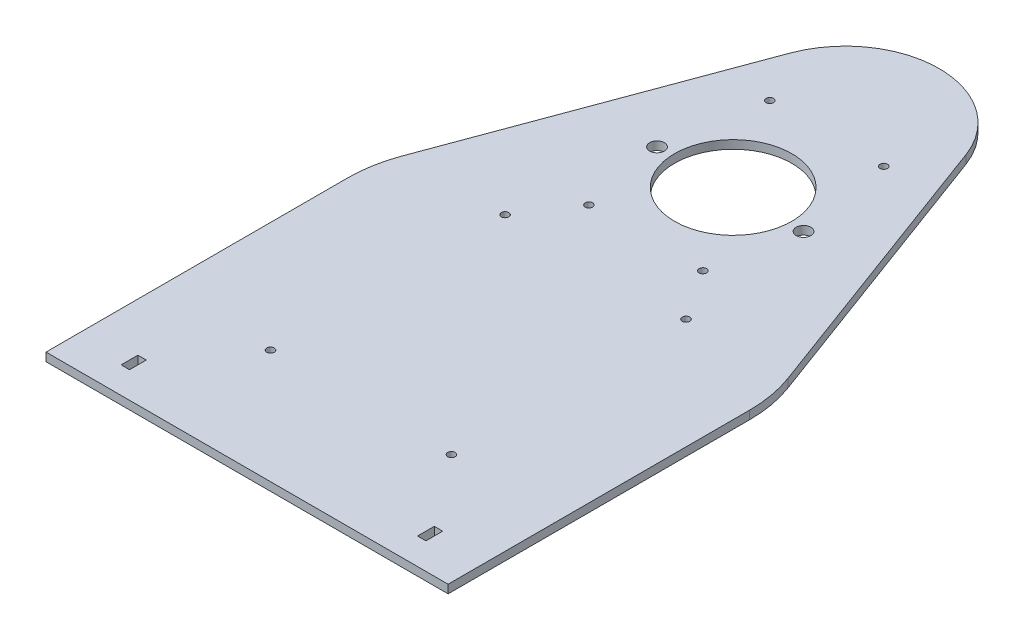
from build123d import *

# Parameters (mm, degrees)
SKETCH3_R           = 22.225
SKETCH3_R_2         = 2.778125
SKETCH3_R_3         = 1.4224
SKETCH3_W           = 3.175
SKETCH3_H           = 6.35
BOSS_EXTRUDE1_DEPTH = 3.175


with BuildPart() as part:
    # Sketch3 → Boss-Extrude1 (new body)
    with BuildSketch(Plane(origin=(0, 0, 0), x_dir=(1, 0, 0), z_dir=(0, 1, 0))):
        with BuildLine():
            Line((0, 0), (0, 114.3))
            ThreePointArc((0, 114.3), (0.796571799, 123.260868714), (3.161305831, 131.940714778))
            Line((3.161305831, 131.940714778), (42.852914082, 239.127776658))
            ThreePointArc((42.852914082, 239.127776658), (76.2, 262.339276313), (109.547085918, 239.127776658))
            Line((109.547085918, 239.127776658), (149.238694169, 131.940714778))
            ThreePointArc((149.238694169, 131.940714778), (151.603428201, 123.260868714), (152.4, 114.3))
            Line((152.4, 114.3), (152.4, 0))
            Line((152.4, 0), (0, 0))
        make_face()
        with Locations((76.2, 184.24413735)):
            Circle(SKETCH3_R, mode=Mode.SUBTRACT)
        with Locations((103.959813902, 183.152998641)):
            Circle(SKETCH3_R_2, mode=Mode.SUBTRACT)
        with Locations((48.440186098, 183.152998641)):
            Circle(SKETCH3_R_2, mode=Mode.SUBTRACT)
        with Locations((41.91, 43.18)):
            Circle(SKETCH3_R_3, mode=Mode.SUBTRACT)
        with Locations((41.91, 132.08)):
            Circle(SKETCH3_R_3, mode=Mode.SUBTRACT)
        with Locations((110.49, 132.08)):
            Circle(SKETCH3_R_3, mode=Mode.SUBTRACT)
        with Locations((110.49, 43.18)):
            Circle(SKETCH3_R_3, mode=Mode.SUBTRACT)
        with Locations((54.61, 151.157668748)):
            Circle(SKETCH3_R_3, mode=Mode.SUBTRACT)
        with Locations((54.61, 219.737668748)):
            Circle(SKETCH3_R_3, mode=Mode.SUBTRACT)
        with Locations((97.79, 151.157668748)):
            Circle(SKETCH3_R_3, mode=Mode.SUBTRACT)
        with Locations((97.79, 219.737668748)):
            Circle(SKETCH3_R_3, mode=Mode.SUBTRACT)
        with Locations((20.0285604, 13.212735966)):
            Rectangle(SKETCH3_W, SKETCH3_H, mode=Mode.SUBTRACT)
        with Locations((132.3714396, 13.212735966)):
            Rectangle(SKETCH3_W, SKETCH3_H, mode=Mode.SUBTRACT)
    extrude(amount=BOSS_EXTRUDE1_DEPTH)


solid = part.part
